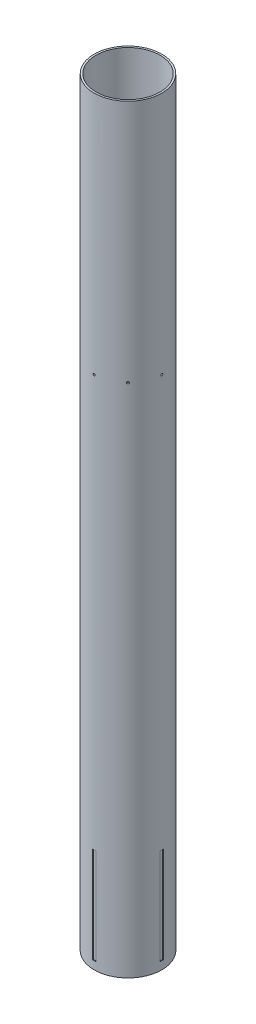
from build123d import *

# Parameters (mm, degrees)
SKETCH1_R                 = 53.721
SKETCH1_R_2               = 50.8
BODY_TUBE_EXTRUSION_DEPTH = 1206.5
ENGINE_BLOCK_HOLE_REACH   = 1214.465
SKETCH2_R                 = 1.6383
CIRPATTERN1_COUNT         = 8
SKETCH3_W                 = 5.334
SKETCH3_H                 = 152.4
CUT_EXTRUDE1_DEPTH        = 1.27
CIRPATTERN2_COUNT         = 4


with BuildPart() as part:
    # Sketch1 → Body Tube Extrusion (new body)
    with BuildSketch(Plane(origin=(0, 0, 0), x_dir=(1, 0, 0), z_dir=(0, 1, 0))):
        Circle(SKETCH1_R)
        Circle(SKETCH1_R_2, mode=Mode.SUBTRACT)
    extrude(amount=BODY_TUBE_EXTRUSION_DEPTH)

    # Sketch2 → Engine Block Hole (cut, up to next)
    with BuildSketch(Plane.XY.offset(53.721), mode=Mode.PRIVATE) as engine_block_hole_sk1:
        with Locations((0, 819.15)):
            Circle(SKETCH2_R)
    engine_block_hole_tool1 = extrude(engine_block_hole_sk1.sketch, amount=-ENGINE_BLOCK_HOLE_REACH, mode=Mode.PRIVATE) & part.part
    engine_block_hole = engine_block_hole_tool1.solids().sort_by_distance((0, 819.15, 53.721))[0]
    add(engine_block_hole, mode=Mode.SUBTRACT)

    # CirPattern1: Engine Block Hole ×8 about axis
    cirpattern1_axis = Axis((0, 1206.5, 0), (0, -1, 0))
    for i in range(1, CIRPATTERN1_COUNT):
        add(engine_block_hole.rotate(cirpattern1_axis, i * 360 / CIRPATTERN1_COUNT), mode=Mode.SUBTRACT)

    # Sketch3 → Cut-Extrude1 (cut)
    with BuildSketch(Plane.XY.offset(53.721)):
        with Locations((0, 88.9)):
            Rectangle(SKETCH3_W, SKETCH3_H)
    cut_extrude1 = extrude(amount=-CUT_EXTRUDE1_DEPTH, mode=Mode.SUBTRACT)

    # CirPattern2: Cut-Extrude1 ×4 about axis
    cirpattern2_axis = Axis((0, 1206.5, 0), (0, -1, 0))
    for i in range(1, CIRPATTERN2_COUNT):
        add(cut_extrude1.rotate(cirpattern2_axis, i * 360 / CIRPATTERN2_COUNT), mode=Mode.SUBTRACT)


solid = part.part
